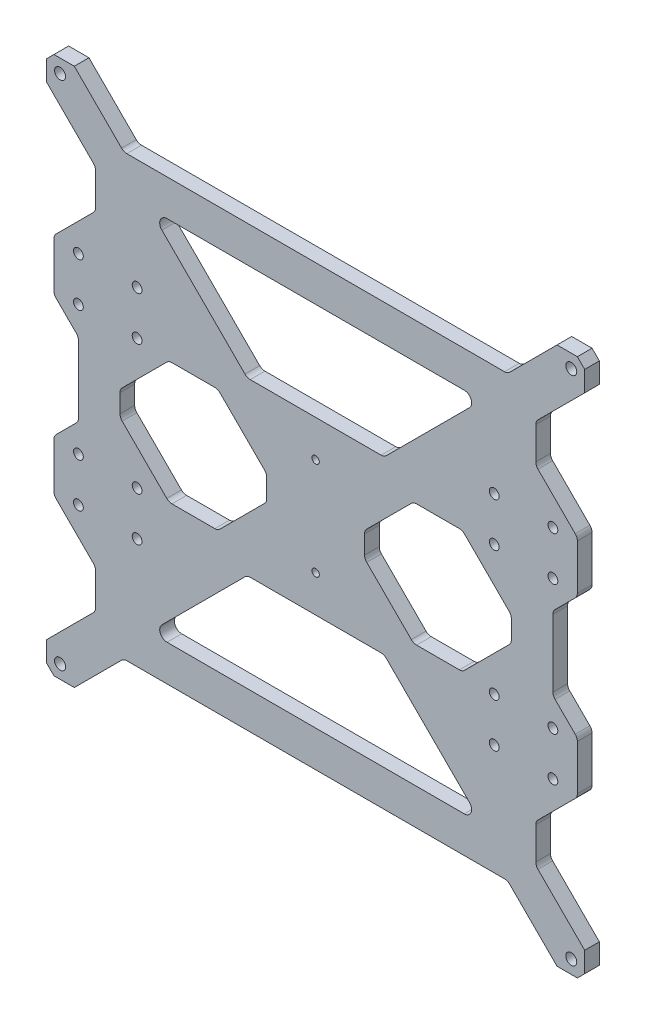
from build123d import *

# Parameters (mm, degrees)
MODEL_R                  = 2.25
MODEL_R_2                = 2
RESSALTO_EXTRUS_O1_DEPTH = 6


with BuildPart() as part:
    # Model → Ressalto-extrusão1 (new body)
    with BuildSketch(Plane.XY):
        with BuildLine():
            Line((25.349783072, 230.240205741), (23.349783072, 230.240205741))
            Line((23.349783072, 230.240205741), (20.349783072, 227.240205741))
            Line((20.349783072, 227.240205741), (20.349783072, 225.240205741))
            Line((20.349783072, 225.240205741), (20.349783072, 223.240205741))
            Line((20.349783072, 223.240205741), (20.349783072, 218.926497242))
            Line((20.349783072, 218.926497242), (39.471103415, 199.805176898))
            ThreePointArc((39.471103415, 199.805176898), (40.121421669, 198.831906852), (40.349783072, 197.683856555))
            Line((40.349783072, 197.683856555), (40.349783072, 184.482846428))
            ThreePointArc((40.349783072, 184.482846428), (40.121421669, 183.334796131), (39.471103415, 182.361526084))
            Line((39.471103415, 182.361526084), (24.228462728, 167.118885397))
            ThreePointArc((24.228462728, 167.118885397), (23.578144474, 166.145615351), (23.349783072, 164.997565054))
            Line((23.349783072, 164.997565054), (23.349783072, 146.49692022))
            ThreePointArc((23.349783072, 146.49692022), (23.578144474, 145.348869923), (24.228462728, 144.375599877))
            Line((24.228462728, 144.375599877), (32.471103415, 136.132959189))
            ThreePointArc((32.471103415, 136.132959189), (33.121421669, 135.159689143), (33.349783072, 134.011638846))
            Line((33.349783072, 134.011638846), (33.349783072, 120.240205741))
            Line((33.349783072, 120.240205741), (33.349783072, 106.468772636))
            ThreePointArc((33.349783072, 106.468772636), (33.121421669, 105.320722339), (32.471103415, 104.347452292))
            Line((32.471103415, 104.347452292), (24.228462728, 96.104811605))
            ThreePointArc((24.228462728, 96.104811605), (23.578144474, 95.131541559), (23.349783072, 93.983491262))
            Line((23.349783072, 93.983491262), (23.349783072, 75.482846428))
            ThreePointArc((23.349783072, 75.482846428), (23.578144474, 74.334796131), (24.228462728, 73.361526084))
            Line((24.228462728, 73.361526084), (39.471103415, 58.118885397))
            ThreePointArc((39.471103415, 58.118885397), (40.121421669, 57.145615351), (40.349783072, 55.997565054))
            Line((40.349783072, 55.997565054), (40.349783072, 42.796554927))
            ThreePointArc((40.349783072, 42.796554927), (40.121421669, 41.64850463), (39.471103415, 40.675234583))
            Line((39.471103415, 40.675234583), (20.349783072, 21.55391424))
            Line((20.349783072, 21.55391424), (20.349783072, 17.240205741))
            Line((20.349783072, 17.240205741), (20.349783072, 15.240205741))
            Line((20.349783072, 15.240205741), (20.349783072, 13.240205741))
            Line((20.349783072, 13.240205741), (23.349783072, 10.240205741))
            Line((23.349783072, 10.240205741), (25.349783072, 10.240205741))
            Line((25.349783072, 10.240205741), (27.349783072, 10.240205741))
            Line((27.349783072, 10.240205741), (31.663491571, 10.240205741))
            Line((31.663491571, 10.240205741), (51.006456133, 29.583170303))
            ThreePointArc((51.006456133, 29.583170303), (51.979726179, 30.233488557), (53.127776476, 30.461849959))
            Line((53.127776476, 30.461849959), (130.349783072, 30.461849959))
            Line((130.349783072, 30.461849959), (207.571789667, 30.461849959))
            ThreePointArc((207.571789667, 30.461849959), (208.719839964, 30.233488557), (209.693110011, 29.583170303))
            Line((209.693110011, 29.583170303), (229.036074573, 10.240205741))
            Line((229.036074573, 10.240205741), (233.349783072, 10.240205741))
            Line((233.349783072, 10.240205741), (235.349783072, 10.240205741))
            Line((235.349783072, 10.240205741), (237.349783072, 10.240205741))
            Line((237.349783072, 10.240205741), (240.349783072, 13.240205741))
            Line((240.349783072, 13.240205741), (240.349783072, 15.240205741))
            Line((240.349783072, 15.240205741), (240.349783072, 17.240205741))
            Line((240.349783072, 17.240205741), (240.349783072, 21.55391424))
            Line((240.349783072, 21.55391424), (221.228462728, 40.675234583))
            ThreePointArc((221.228462728, 40.675234583), (220.578144474, 41.64850463), (220.349783072, 42.796554927))
            Line((220.349783072, 42.796554927), (220.349783072, 55.997565054))
            ThreePointArc((220.349783072, 55.997565054), (220.578144474, 57.145615351), (221.228462728, 58.118885397))
            Line((221.228462728, 58.118885397), (236.471103415, 73.361526084))
            ThreePointArc((236.471103415, 73.361526084), (237.121421669, 74.334796131), (237.349783072, 75.482846428))
            Line((237.349783072, 75.482846428), (237.349783072, 93.983491262))
            ThreePointArc((237.349783072, 93.983491262), (237.121421669, 95.131541559), (236.471103415, 96.104811605))
            Line((236.471103415, 96.104811605), (228.228462728, 104.347452292))
            ThreePointArc((228.228462728, 104.347452292), (227.578144474, 105.320722339), (227.349783072, 106.468772636))
            Line((227.349783072, 106.468772636), (227.349783072, 120.240205741))
            Line((227.349783072, 120.240205741), (227.349783072, 134.011638846))
            ThreePointArc((227.349783072, 134.011638846), (227.578144474, 135.159689143), (228.228462728, 136.132959189))
            Line((228.228462728, 136.132959189), (236.471103415, 144.375599877))
            ThreePointArc((236.471103415, 144.375599877), (237.121421669, 145.348869923), (237.349783072, 146.49692022))
            Line((237.349783072, 146.49692022), (237.349783072, 164.997565054))
            ThreePointArc((237.349783072, 164.997565054), (237.121421669, 166.145615351), (236.471103415, 167.118885397))
            Line((236.471103415, 167.118885397), (221.228462728, 182.361526084))
            ThreePointArc((221.228462728, 182.361526084), (220.578144474, 183.334796131), (220.349783072, 184.482846428))
            Line((220.349783072, 184.482846428), (220.349783072, 197.683856555))
            ThreePointArc((220.349783072, 197.683856555), (220.578144474, 198.831906852), (221.228462728, 199.805176898))
            Line((221.228462728, 199.805176898), (240.349783072, 218.926497242))
            Line((240.349783072, 218.926497242), (240.349783072, 223.240205741))
            Line((240.349783072, 223.240205741), (240.349783072, 225.240205741))
            Line((240.349783072, 225.240205741), (240.349783072, 227.240205741))
            Line((240.349783072, 227.240205741), (237.349783072, 230.240205741))
            Line((237.349783072, 230.240205741), (235.349783072, 230.240205741))
            Line((235.349783072, 230.240205741), (233.349783072, 230.240205741))
            Line((233.349783072, 230.240205741), (229.036074573, 230.240205741))
            Line((229.036074573, 230.240205741), (209.693110011, 210.897241179))
            ThreePointArc((209.693110011, 210.897241179), (208.719839964, 210.246922925), (207.571789667, 210.018561523))
            Line((207.571789667, 210.018561523), (130.349783072, 210.018561523))
            Line((130.349783072, 210.018561523), (53.127776476, 210.018561523))
            ThreePointArc((53.127776476, 210.018561523), (51.979726179, 210.246922925), (51.006456133, 210.897241179))
            Line((51.006456133, 210.897241179), (31.663491571, 230.240205741))
            Line((31.663491571, 230.240205741), (27.349783072, 230.240205741))
            Line((27.349783072, 230.240205741), (25.349783072, 230.240205741))
        make_face()
        with Locations((25.849783072, 224.740205741)):
            Circle(MODEL_R, mode=Mode.SUBTRACT)
        with Locations((57.349783072, 164.747242637)):
            Circle(MODEL_R_2, mode=Mode.SUBTRACT)
        with Locations((57.349783072, 146.747242637)):
            Circle(MODEL_R_2, mode=Mode.SUBTRACT)
        with Locations((33.349783072, 146.747242637)):
            Circle(MODEL_R_2, mode=Mode.SUBTRACT)
        with Locations((33.349783072, 164.747242637)):
            Circle(MODEL_R_2, mode=Mode.SUBTRACT)
        with Locations((234.849783072, 224.740205741)):
            Circle(MODEL_R, mode=Mode.SUBTRACT)
        with Locations((203.349783072, 164.747242637)):
            Circle(MODEL_R_2, mode=Mode.SUBTRACT)
        with Locations((203.349783072, 146.747242637)):
            Circle(MODEL_R_2, mode=Mode.SUBTRACT)
        with Locations((227.349783072, 146.747242637)):
            Circle(MODEL_R_2, mode=Mode.SUBTRACT)
        with Locations((227.349783072, 164.747242637)):
            Circle(MODEL_R_2, mode=Mode.SUBTRACT)
        with Locations((25.849783072, 15.740205741)):
            Circle(MODEL_R, mode=Mode.SUBTRACT)
        with Locations((57.349783072, 75.733168845)):
            Circle(MODEL_R_2, mode=Mode.SUBTRACT)
        with Locations((57.349783072, 93.733168845)):
            Circle(MODEL_R_2, mode=Mode.SUBTRACT)
        with Locations((33.349783072, 93.733168845)):
            Circle(MODEL_R_2, mode=Mode.SUBTRACT)
        with Locations((33.349783072, 75.733168845)):
            Circle(MODEL_R_2, mode=Mode.SUBTRACT)
        with Locations((234.849783072, 15.740205741)):
            Circle(MODEL_R, mode=Mode.SUBTRACT)
        with Locations((203.349783072, 75.733168845)):
            Circle(MODEL_R_2, mode=Mode.SUBTRACT)
        with Locations((203.349783072, 93.733168845)):
            Circle(MODEL_R_2, mode=Mode.SUBTRACT)
        with Locations((227.349783072, 93.733168845)):
            Circle(MODEL_R_2, mode=Mode.SUBTRACT)
        with Locations((227.349783072, 75.733168845)):
            Circle(MODEL_R_2, mode=Mode.SUBTRACT)
        with BuildLine():
            Line((130.349783072, 155.240205741), (103.592423759, 155.240205741))
            ThreePointArc((103.592423759, 155.240205741), (102.444373462, 155.468567143), (101.471103415, 156.118885397))
            Line((101.471103415, 156.118885397), (67.471103415, 190.118885397))
            ThreePointArc((67.471103415, 190.118885397), (66.820785161, 193.388256038), (69.592423759, 195.240205741))
            Line((69.592423759, 195.240205741), (130.349783072, 195.240205741))
            Line((130.349783072, 195.240205741), (191.107142385, 195.240205741))
            ThreePointArc((191.107142385, 195.240205741), (193.878780982, 193.388256038), (193.228462728, 190.118885397))
            Line((193.228462728, 190.118885397), (159.228462728, 156.118885397))
            ThreePointArc((159.228462728, 156.118885397), (158.255192682, 155.468567143), (157.107142385, 155.240205741))
            Line((157.107142385, 155.240205741), (130.349783072, 155.240205741))
        make_face(mode=Mode.SUBTRACT)
        with BuildLine():
            Line((51.228462728, 126.118885397), (69.471103415, 144.361526084))
            ThreePointArc((69.471103415, 144.361526084), (70.444373462, 145.011844338), (71.592423759, 145.240205741))
            Line((71.592423759, 145.240205741), (89.107142385, 145.240205741))
            ThreePointArc((89.107142385, 145.240205741), (90.255192682, 145.011844338), (91.228462728, 144.361526084))
            Line((91.228462728, 144.361526084), (109.471103415, 126.118885397))
            ThreePointArc((109.471103415, 126.118885397), (110.121421669, 125.145615351), (110.349783072, 123.997565054))
            Line((110.349783072, 123.997565054), (110.349783072, 120.240205741))
            Line((110.349783072, 120.240205741), (110.349783072, 116.482846428))
            ThreePointArc((110.349783072, 116.482846428), (110.121421669, 115.334796131), (109.471103415, 114.361526084))
            Line((109.471103415, 114.361526084), (91.228462728, 96.118885397))
            ThreePointArc((91.228462728, 96.118885397), (90.255192682, 95.468567143), (89.107142385, 95.240205741))
            Line((89.107142385, 95.240205741), (71.592423759, 95.240205741))
            ThreePointArc((71.592423759, 95.240205741), (70.444373462, 95.468567143), (69.471103415, 96.118885397))
            Line((69.471103415, 96.118885397), (51.228462728, 114.361526084))
            ThreePointArc((51.228462728, 114.361526084), (50.578144474, 115.334796131), (50.349783072, 116.482846428))
            Line((50.349783072, 116.482846428), (50.349783072, 120.240205741))
            Line((50.349783072, 120.240205741), (50.349783072, 123.997565054))
            ThreePointArc((50.349783072, 123.997565054), (50.578144474, 125.145615351), (51.228462728, 126.118885397))
        make_face(mode=Mode.SUBTRACT)
        with BuildLine():
            Line((209.471103415, 126.118885397), (191.228462728, 144.361526084))
            ThreePointArc((191.228462728, 144.361526084), (190.255192682, 145.011844338), (189.107142385, 145.240205741))
            Line((189.107142385, 145.240205741), (171.592423759, 145.240205741))
            ThreePointArc((171.592423759, 145.240205741), (170.444373462, 145.011844338), (169.471103415, 144.361526084))
            Line((169.471103415, 144.361526084), (151.228462728, 126.118885397))
            ThreePointArc((151.228462728, 126.118885397), (150.578144474, 125.145615351), (150.349783072, 123.997565054))
            Line((150.349783072, 123.997565054), (150.349783072, 120.240205741))
            Line((150.349783072, 120.240205741), (150.349783072, 116.482846428))
            ThreePointArc((150.349783072, 116.482846428), (150.578144474, 115.334796131), (151.228462728, 114.361526084))
            Line((151.228462728, 114.361526084), (169.471103415, 96.118885397))
            ThreePointArc((169.471103415, 96.118885397), (170.444373462, 95.468567143), (171.592423759, 95.240205741))
            Line((171.592423759, 95.240205741), (189.107142385, 95.240205741))
            ThreePointArc((189.107142385, 95.240205741), (190.255192682, 95.468567143), (191.228462728, 96.118885397))
            Line((191.228462728, 96.118885397), (209.471103415, 114.361526084))
            ThreePointArc((209.471103415, 114.361526084), (210.121421669, 115.334796131), (210.349783072, 116.482846428))
            Line((210.349783072, 116.482846428), (210.349783072, 120.240205741))
            Line((210.349783072, 120.240205741), (210.349783072, 123.997565054))
            ThreePointArc((210.349783072, 123.997565054), (210.121421669, 125.145615351), (209.471103415, 126.118885397))
        make_face(mode=Mode.SUBTRACT)
        with BuildLine():
            Line((130.349783072, 85.240205741), (103.592423759, 85.240205741))
            ThreePointArc((103.592423759, 85.240205741), (102.444373462, 85.011844338), (101.471103415, 84.361526084))
            Line((101.471103415, 84.361526084), (67.471103415, 50.361526084))
            ThreePointArc((67.471103415, 50.361526084), (66.820785161, 47.092155444), (69.592423759, 45.240205741))
            Line((69.592423759, 45.240205741), (130.349783072, 45.240205741))
            Line((130.349783072, 45.240205741), (191.107142385, 45.240205741))
            ThreePointArc((191.107142385, 45.240205741), (193.878780982, 47.092155444), (193.228462728, 50.361526084))
            Line((193.228462728, 50.361526084), (159.228462728, 84.361526084))
            ThreePointArc((159.228462728, 84.361526084), (158.255192682, 85.011844338), (157.107142385, 85.240205741))
            Line((157.107142385, 85.240205741), (130.349783072, 85.240205741))
        make_face(mode=Mode.SUBTRACT)
        with BuildLine():
            ThreePointArc((130.349783072, 141.740205741), (128.849783072, 140.240205741), (130.349783072, 138.740205741))
            ThreePointArc((130.349783072, 138.740205741), (131.849783072, 140.240205741), (130.349783072, 141.740205741))
        make_face(mode=Mode.SUBTRACT)
        with BuildLine():
            ThreePointArc((130.349783072, 101.740205741), (128.849783072, 100.240205741), (130.349783072, 98.740205741))
            ThreePointArc((130.349783072, 98.740205741), (131.849783072, 100.240205741), (130.349783072, 101.740205741))
        make_face(mode=Mode.SUBTRACT)
    extrude(amount=RESSALTO_EXTRUS_O1_DEPTH)


solid = part.part
